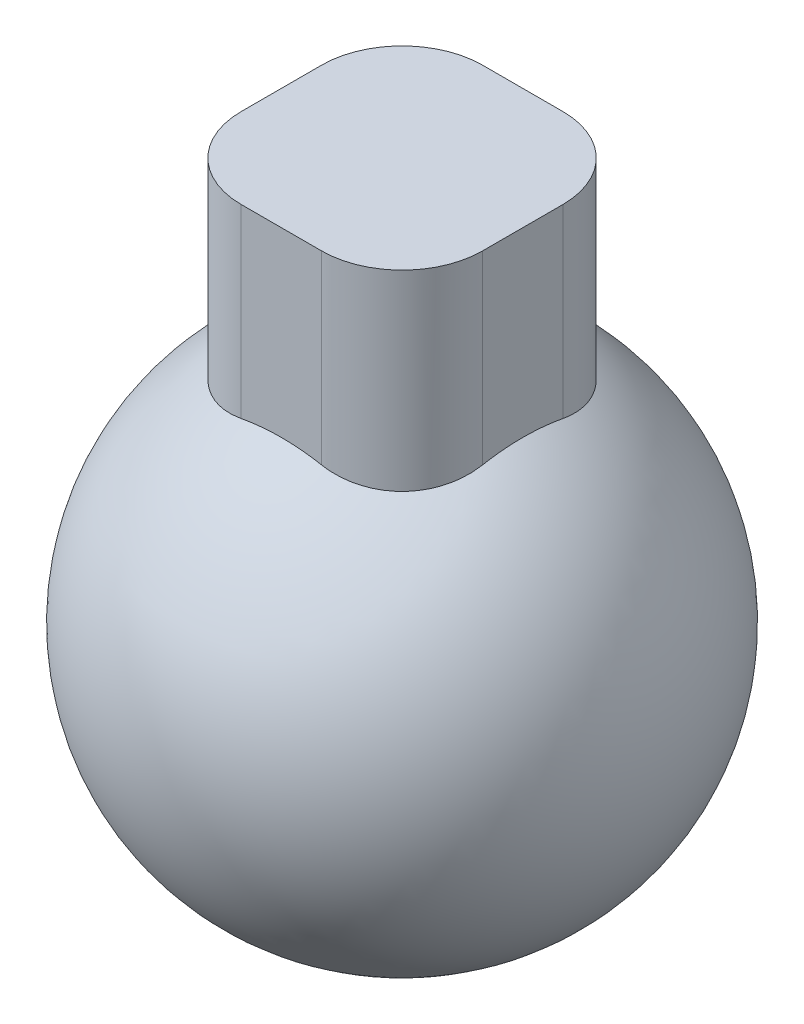
from build123d import *

# Parameters (mm, degrees)
SKETCH2_W           = 15.24
SKETCH2_H           = 15.24
BOSS_EXTRUDE1_DEPTH = 25.4
FILLET1_R           = 5.08


with BuildPart() as part:
    # Sketch1 → Revolve1 (revolve)
    with BuildSketch(Plane.XY):
        with BuildLine():
            Line((0, -15.875), (0, 15.875))
            ThreePointArc((0, 15.875), (15.875, 0), (0, -15.875))
        make_face()
    revolve(axis=Axis((0, -15.875, 0), (0, 1, 0)))

    # Sketch2 → Boss-Extrude1 (add)
    with BuildSketch(Plane(origin=(0, 0, 0), x_dir=(1, 0, 0), z_dir=(0, 1, 0))):
        Rectangle(SKETCH2_W, SKETCH2_H)
    extrude(amount=BOSS_EXTRUDE1_DEPTH)

    # Fillet1
    fillet1_edges = [part.edges().sort_by_distance(p)[0] for p in [
        (-7.62, 18.528525221, 7.62),
        (7.62, 18.528525221, 7.62),
        (-7.62, 18.528525221, -7.62),
        (7.62, 18.528525221, -7.62),
    ]]
    fillet(fillet1_edges, radius=FILLET1_R)


solid = part.part
